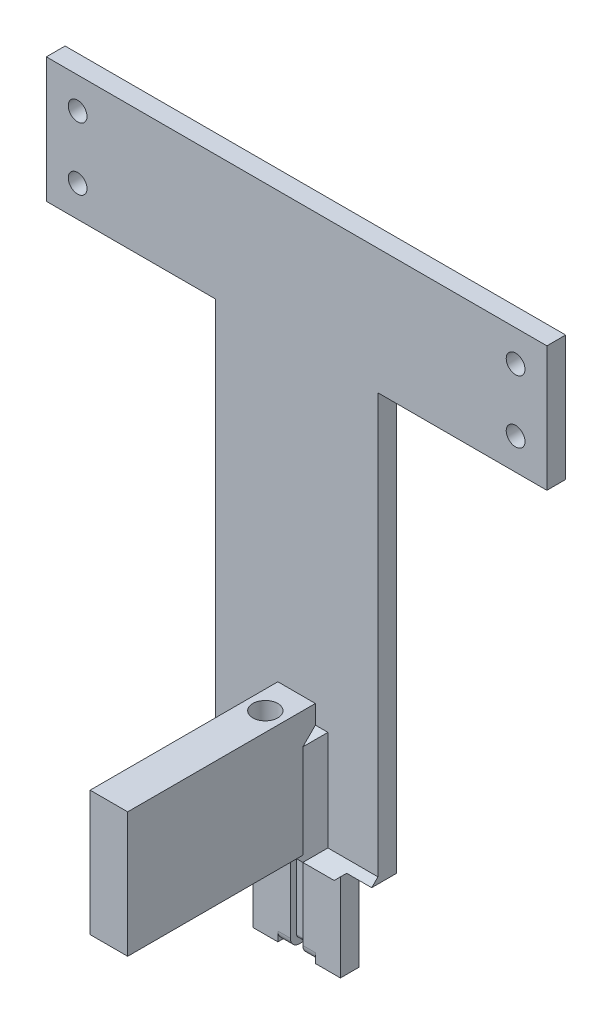
from build123d import *

# Parameters (mm, degrees)
SKETCH_1_W           = 80
SKETCH_1_H           = 20
EXTRUDE_1_DEPTH      = 3
SKETCH_2_W           = 6
SKETCH_2_H           = 20
EXTRUDE_2_DEPTH      = 95
SKETCH_3_W           = 6
SKETCH_3_H           = 15
EXTRUDE_3_DEPTH      = 80
CHAMFER_1_SIZE       = 10
CHAMFER_2_SIZE       = 10
FILLET_1_R           = 10
SKETCH_4_W           = 6
SKETCH_4_H           = 15
EXTRUDE_4_DEPTH      = 5
SKETCH_5_W           = 6
SKETCH_5_H           = 15
EXTRUDE_5_DEPTH      = 5
FILLET_2_R           = 2
CHAMFER_3_SIZE       = 3
SKETCH_6_R           = 1.5
CUT_EXTRUDE_1_DEPTH  = 30
SKETCH_7_W           = 26
SKETCH_7_H           = 3
EXTRUDE_6_DEPTH      = 68
CHAMFER_4_SIZE       = 10
SKETCH_8_W           = 6
SKETCH_8_H           = 13
EXTRUDE_7_DEPTH      = 100
CHAMFER_5_SIZE       = 5
CHAMFER_6_SIZE       = 2
SKETCH_9_W           = 99.532664039
SKETCH_9_H           = 104.077347625
CUT_EXTRUDE_3_DEPTH  = 30
SKETCH_14_W          = 15.593287018
SKETCH_14_H          = 53.78968733
CUT_EXTRUDE_5_DEPTH  = 57
SKETCH_15_W          = 6
SKETCH_15_H          = 25
EXTRUDE_8_DEPTH      = 5
SKETCH_16_W          = 6
SKETCH_16_H          = 25
EXTRUDE_9_DEPTH      = 5
CHAMFER_7_SIZE       = 5
SKETCH_17_W          = 6
SKETCH_17_H          = 23
CUT_EXTRUDE_6_DEPTH  = 100
SKETCH_20_W          = 26.699145715
SKETCH_20_H          = 4.006007242
CUT_EXTRUDE_7_DEPTH  = 133
SKETCH_21_W          = 6
SKETCH_21_H          = 15
EXTRUDE_11_DEPTH     = 30
SKETCH_22_R          = 2
CUT_EXTRUDE_8_DEPTH  = 27
EXTRUDE_12_DEPTH     = 3
SKETCH_26_W          = 4
SKETCH_26_H          = 3
EXTRUDE_14_DEPTH     = 16
SKETCH_27_W          = 4
SKETCH_27_H          = 13
EXTRUDE_21_DEPTH     = 6
SKETCH_28_R          = 1.5
CUT_EXTRUDE_9_DEPTH  = 22
CHAMFER_9_SIZE       = 2
CHAMFER_10_SIZE      = 2
CHAMFER_11_SIZE      = 1
SKETCH_29_W          = 6
SKETCH_29_H          = 28
EXTRUDE_22_DEPTH     = 20
SKETCH_30_W          = 6
SKETCH_30_H          = 20
EXTRUDE_23_DEPTH     = 2
CUT_EXTRUDE_START    = -20
SKETCH_31_R          = 2
CUT_EXTRUDE_10_DEPTH = 20
SKETCH_32_R          = 1.5
CUT_EXTRUDE_11_DEPTH = 10
SKETCH_33_W          = 6
SKETCH_33_H          = 30
CUT_EXTRUDE_12_DEPTH = 15
CUT_EXTRUDE_13_DEPTH = 6
EXTRUDE_24_DEPTH     = 2
EXTRUDE_25_REACH     = 136.146
SKETCH_37_W          = 2
SKETCH_37_H          = 3
EXTRUDE_26_DEPTH     = 2
EXTRUDE_27_DEPTH     = 2
EXTRUDE_28_REACH     = 136.146
CHAMFER_12_SIZE      = 1


# Some blends are built 0.0001 mm under size
with BuildPart() as part:
    # 草图1 → 凸台-拉伸1 (new body)
    with BuildSketch(Plane.XY):
        with Locations((-40, 10)):
            Rectangle(SKETCH_1_W, SKETCH_1_H)
    extrude(amount=EXTRUDE_1_DEPTH)

    # 草图2 → 凸台-拉伸2 (add)
    with BuildSketch(Plane.XY.offset(3)):
        with Locations((-40, 10)):
            Rectangle(SKETCH_2_W, SKETCH_2_H)
    extrude(amount=EXTRUDE_2_DEPTH)

    # 草图3 → 凸台-拉伸3 (add)
    with BuildSketch(Plane.XZ):
        with Locations((-40, 90.5)):
            Rectangle(SKETCH_3_W, SKETCH_3_H)
    extrude(amount=EXTRUDE_3_DEPTH)

    # 倒角1
    chamfer_1_edges = [part.edges().sort_by_distance(p)[0] for p in [
        (-43, 10, 3),
        (-37, 10, 3),
    ]]
    chamfer(chamfer_1_edges, length=CHAMFER_1_SIZE)

    # 倒角2
    chamfer_2_edges = [part.edges().sort_by_distance(p)[0] for p in [
        (-40, 0, 83),
    ]]
    chamfer(chamfer_2_edges, length=CHAMFER_2_SIZE)

    # 圆角1
    fillet_1_edges = [part.edges().sort_by_distance(p)[0] for p in [
        (-40, 20, 98),
    ]]
    fillet(fillet_1_edges, radius=FILLET_1_R)

    # 草图4 → 凸台-拉伸4 (add)
    with BuildSketch(Plane(origin=(0, 0, 83), x_dir=(-1, 0, 0), z_dir=(0, 0, -1))):
        with Locations((40, -72.5)):
            Rectangle(SKETCH_4_W, SKETCH_4_H)
    extrude(amount=EXTRUDE_4_DEPTH)

    # 草图5 → 凸台-拉伸5 (add)
    with BuildSketch(Plane.XY.offset(98)):
        with Locations((-40, -72.5)):
            Rectangle(SKETCH_5_W, SKETCH_5_H)
    extrude(amount=EXTRUDE_5_DEPTH)

    # 圆角2
    fillet_2_edges = [part.edges().sort_by_distance(p)[0] for p in [
        (-40, -65, 78),
        (-40, -65, 103),
    ]]
    fillet(fillet_2_edges, radius=FILLET_2_R)

    # 倒角3
    chamfer_3_edges = [part.edges().sort_by_distance(p)[0] for p in [
        (-40, -65, 83),
        (-40, -65, 98),
    ]]
    chamfer(chamfer_3_edges, length=CHAMFER_3_SIZE - 0.0001)  # a hair under: the kernel refuses the full size

    # 草图6 → 切除-拉伸1 (cut)
    with BuildSketch(Plane.XZ):
        with Locations(Location((-40, 8, 0), (0, 0, 270))):
            Circle(SKETCH_6_R)
        with Locations(Location((-40, 23, 0), (0, 0, 270))):
            Circle(SKETCH_6_R)
    extrude(amount=-CUT_EXTRUDE_1_DEPTH, mode=Mode.SUBTRACT)

    # 草图7 → 凸台-拉伸6 (add)
    with BuildSketch(Plane.XZ):
        with Locations((-40, 1.5)):
            Rectangle(SKETCH_7_W, SKETCH_7_H)
    extrude(amount=EXTRUDE_6_DEPTH)

    # 倒角4
    chamfer_4_edges = [part.edges().sort_by_distance(p)[0] for p in [
        (-53, -68, 1.5),
        (-27, -68, 1.5),
    ]]
    chamfer(chamfer_4_edges, length=CHAMFER_4_SIZE)

    # 草图8 → 凸台-拉伸7 (add)
    with BuildSketch(Plane.XY.offset(3)):
        with Locations((-40, -73.5)):
            Rectangle(SKETCH_8_W, SKETCH_8_H)
    extrude(amount=EXTRUDE_7_DEPTH)

    # 倒角5
    chamfer_5_edges = [part.edges().sort_by_distance(p)[0] for p in [
        (-40, -67, 3),
    ]]
    chamfer(chamfer_5_edges, length=CHAMFER_5_SIZE)

    # 倒角6
    # the kernel refuses this chamfer: 2 mm, written as the material it adds along each edge
    with BuildSketch(Plane(origin=(-37, -56.856634024, 3), x_dir=(1, 0, 0), z_dir=(0, -1, 0))) as chamfer_6_piece_1_section:
        Polygon((CHAMFER_6_SIZE, 0), (0, CHAMFER_6_SIZE), (0, 0), align=None)
    chamfer_6_piece_1 = extrude(amount=16.286731952, mode=Mode.PRIVATE)
    chamfer_6_piece_1 = split(chamfer_6_piece_1, bisect_by=Plane(origin=(-37, -59.428317012, 0.428317012), z_dir=(0, -0.7071067811865476, -0.7071067811865476)), keep=Keep.TOP, mode=Mode.PRIVATE)
    chamfer_6_piece_1 = split(chamfer_6_piece_1, bisect_by=Plane(origin=(-31.428317012, -62.428317012, 3), z_dir=(-0.7071067811865475, 0.7071067811865477, -1.922962686383564e-15)), keep=Keep.TOP, mode=Mode.PRIVATE)
    add(chamfer_6_piece_1)
    with BuildSketch(Plane(origin=(-43, -73.143365976, 3), x_dir=(-1, 0, 0), z_dir=(0, 1, 0))) as chamfer_6_piece_2_section:
        Polygon((CHAMFER_6_SIZE, 0), (0, CHAMFER_6_SIZE), (0, 0), align=None)
    chamfer_6_piece_2 = extrude(amount=16.286731952, mode=Mode.PRIVATE)
    chamfer_6_piece_2 = split(chamfer_6_piece_2, bisect_by=Plane(origin=(-43, -67.571682988, 8.571682988), z_dir=(0, -0.7071067811865476, -0.7071067811865476)), keep=Keep.TOP, mode=Mode.PRIVATE)
    chamfer_6_piece_2 = split(chamfer_6_piece_2, bisect_by=Plane(origin=(-40.428317012, -70.571682988, 3), z_dir=(0.7071067811865476, 0.7071067811865476, 3.5574809698095944e-15)), keep=Keep.TOP, mode=Mode.PRIVATE)
    add(chamfer_6_piece_2)

    # 草图9 → 切除-拉伸3 (cut)
    with BuildSketch(Plane(origin=(0, 20, 0), x_dir=(1, 0, 0), z_dir=(0, 1, 0))):
        with Locations((-30.233667981, -55.038673813)):
            Rectangle(SKETCH_9_W, SKETCH_9_H)
    extrude(amount=-CUT_EXTRUDE_3_DEPTH, mode=Mode.SUBTRACT)

    # 草图14 → 切除-拉伸5 (cut)
    with BuildSketch(Plane(origin=(0, -10, 0), x_dir=(1, 0, 0), z_dir=(0, 1, 0))):
        with Locations((-38.927067407, -81.040006974)):
            Rectangle(SKETCH_14_W, SKETCH_14_H)
    extrude(amount=-CUT_EXTRUDE_5_DEPTH, mode=Mode.SUBTRACT)

    # 草图15 → 凸台-拉伸8 (add)
    with BuildSketch(Plane(origin=(0, -67, 0), x_dir=(1, 0, 0), z_dir=(0, 1, 0))):
        with Locations((-40, -90.5)):
            Rectangle(SKETCH_15_W, SKETCH_15_H)
    extrude(amount=EXTRUDE_8_DEPTH)

    # 草图16 → 凸台-拉伸9 (add)
    with BuildSketch(Plane.XZ.offset(80)):
        with Locations((-40, 90.5)):
            Rectangle(SKETCH_16_W, SKETCH_16_H)
    extrude(amount=EXTRUDE_9_DEPTH)

    # 倒角7
    chamfer_7_edges = [part.edges().sort_by_distance(p)[0] for p in [
        (-40, -80, 78),
        (-40, -67, 78),
    ]]
    chamfer(chamfer_7_edges, length=CHAMFER_7_SIZE - 0.0001)  # a hair under: the kernel refuses the full size

    # 草图17 → 切除-拉伸6 (cut)
    with BuildSketch(Plane.XY.offset(103)):
        with Locations((-40, -73.5)):
            Rectangle(SKETCH_17_W, SKETCH_17_H)
    extrude(amount=-CUT_EXTRUDE_6_DEPTH, mode=Mode.SUBTRACT)

    # 草图20 → 切除-拉伸7 (cut)
    with BuildSketch(Plane(origin=(0, 20, 0), x_dir=(1, 0, 0), z_dir=(0, 1, 0))):
        with Locations((-37.936501357, -5.003003621)):
            Rectangle(SKETCH_20_W, SKETCH_20_H)
    extrude(amount=-CUT_EXTRUDE_7_DEPTH, mode=Mode.SUBTRACT)

    # 草图21 → 凸台-拉伸11 (add)
    with BuildSketch(Plane.XY.offset(3)):
        with Locations((-40, -60.5)):
            Rectangle(SKETCH_21_W, SKETCH_21_H)
    extrude(amount=EXTRUDE_11_DEPTH)

    # 草图22 → 切除-拉伸8 (cut)
    with BuildSketch(Plane(origin=(0, -53, 0), x_dir=(1, 0, 0), z_dir=(0, 1, 0))):
        with Locations(Location((-40, -8, 0), (0, 0, 270))):
            Circle(SKETCH_22_R)
    extrude(amount=-CUT_EXTRUDE_8_DEPTH, mode=Mode.SUBTRACT)

    # 草图24 → 凸台-拉伸12 (add)
    with BuildSketch(Plane(origin=(0, 0, 0), x_dir=(-1, 0, 0), z_dir=(0, 0, -1))):
        Polygon((27, -58), (27, -68), (37, -68), align=None)
        Polygon((53, -58), (53, -68), (43, -68), align=None)
    extrude(amount=-EXTRUDE_12_DEPTH)

    # 草图26 → 凸台-拉伸14 (add)
    with BuildSketch(Plane.XZ.offset(68)):
        with Locations((-45, 1.5)):
            Rectangle(SKETCH_26_W, SKETCH_26_H)
        with Locations((-35, 1.5)):
            Rectangle(SKETCH_26_W, SKETCH_26_H)
    extrude(amount=EXTRUDE_14_DEPTH)

    # 草图27 → 凸台-拉伸21 (add)
    with BuildSketch(Plane.XY.offset(3)):
        with Locations((-45, -75.5)):
            Rectangle(SKETCH_27_W, SKETCH_27_H)
        with Locations((-35, -75.5)):
            Rectangle(SKETCH_27_W, SKETCH_27_H)
    extrude(amount=EXTRUDE_21_DEPTH)

    # 草图28 → 切除-拉伸9 (cut)
    with BuildSketch(Plane(origin=(-33, 0, 0), x_dir=(0, 0, -1), z_dir=(1, 0, 0))):
        with Locations((-6, -75.5)):
            Circle(SKETCH_28_R)
    extrude(amount=-CUT_EXTRUDE_9_DEPTH, mode=Mode.SUBTRACT)

    # 倒角8
    # the kernel refuses this chamfer: 2 mm, written as the material it adds along each edge
    with BuildSketch(Plane(origin=(-53.152771873, -69, 3), x_dir=(0, 1, 0), z_dir=(1, 0, 0))) as chamfer_8_piece_1_section:
        with BuildLine():
            Line((2.424264069, -0.424264069), (-0.424264069, 2.424264069))
            Line((-0.424264069, 2.424264069), (-0.724264069, 2.424264069))
            ThreePointArc((-0.724264069, 2.424264069), (-0.3, 1.212132034), (-0.3, 0))
            Line((-0.3, 0), (0, -0.3))
            ThreePointArc((0, -0.3), (1.212132034, -0.3), (2.424264069, -0.724264069))
            Line((2.424264069, -0.724264069), (2.424264069, -0.424264069))
        make_face()
    chamfer_8_piece_1 = extrude(amount=10.152771873, mode=Mode.PRIVATE)
    chamfer_8_piece_1 = split(chamfer_8_piece_1, bisect_by=Plane(origin=(-47, -69, 3), z_dir=(-1, 0, 0)), keep=Keep.TOP, mode=Mode.PRIVATE)
    chamfer_8_piece_1 = split(chamfer_8_piece_1, bisect_by=Plane(origin=(-53.152771873, -68, 3), z_dir=(0, 1, 0)), keep=Keep.TOP, mode=Mode.PRIVATE)
    chamfer_8_piece_1 = split(chamfer_8_piece_1, bisect_by=Plane(origin=(-53, -69, 3), z_dir=(1, 0, 0)), keep=Keep.TOP, mode=Mode.PRIVATE)
    add(chamfer_8_piece_1)
    with BuildSketch(Plane(origin=(-47, -69, 3), x_dir=(0, 1, 0), z_dir=(1, 0, 0))) as chamfer_8_piece_2_section:
        with BuildLine():
            Line((2.424264069, -0.424264069), (-0.424264069, 2.424264069))
            Line((-0.424264069, 2.424264069), (-0.724264069, 2.424264069))
            ThreePointArc((-0.724264069, 2.424264069), (-0.3, 1.212132034), (-0.3, 0))
            Line((-0.3, 0), (0, -0.3))
            ThreePointArc((0, -0.3), (1.212132034, -0.3), (2.424264069, -0.724264069))
            Line((2.424264069, -0.724264069), (2.424264069, -0.424264069))
        make_face()
    chamfer_8_piece_2 = extrude(amount=4, mode=Mode.PRIVATE)
    chamfer_8_piece_2 = split(chamfer_8_piece_2, bisect_by=Plane(origin=(-47, -68, 3), z_dir=(0, 1, 0)), keep=Keep.TOP, mode=Mode.PRIVATE)
    add(chamfer_8_piece_2)
    with BuildSketch(Plane(origin=(-47, -69, 3), x_dir=(0, 1, 0), z_dir=(1, 0, 0))) as chamfer_8_piece_3_section:
        with BuildLine():
            Line((2.424264069, -0.424264069), (-0.424264069, 2.424264069))
            Line((-0.424264069, 2.424264069), (-0.724264069, 2.424264069))
            ThreePointArc((-0.724264069, 2.424264069), (-0.3, 1.212132034), (-0.3, 0))
            Line((-0.3, 0), (0, -0.3))
            ThreePointArc((0, -0.3), (1.212132034, -0.3), (2.424264069, -0.724264069))
            Line((2.424264069, -0.724264069), (2.424264069, -0.424264069))
        make_face()
    chamfer_8_piece_3 = extrude(amount=4, mode=Mode.PRIVATE)
    chamfer_8_piece_3 = split(chamfer_8_piece_3, bisect_by=Plane(origin=(-47, -68, 3), z_dir=(0, -1, 0)), keep=Keep.TOP, mode=Mode.PRIVATE)
    add(chamfer_8_piece_3)
    with BuildSketch(Plane(origin=(-47, -69, 3), x_dir=(0, 1, 0), z_dir=(1, 0, 0))) as chamfer_8_piece_4_section:
        with BuildLine():
            Line((2.424264069, -0.424264069), (-0.424264069, 2.424264069))
            Line((-0.424264069, 2.424264069), (-0.724264069, 2.424264069))
            ThreePointArc((-0.724264069, 2.424264069), (-0.3, 1.212132034), (-0.3, 0))
            Line((-0.3, 0), (0, -0.3))
            ThreePointArc((0, -0.3), (1.212132034, -0.3), (2.424264069, -0.724264069))
            Line((2.424264069, -0.724264069), (2.424264069, -0.424264069))
        make_face()
    chamfer_8_piece_4 = extrude(amount=10.152771873, mode=Mode.PRIVATE)
    chamfer_8_piece_4 = split(chamfer_8_piece_4, bisect_by=Plane(origin=(-37, -69, 3), z_dir=(-1, 0, 0)), keep=Keep.TOP, mode=Mode.PRIVATE)
    chamfer_8_piece_4 = split(chamfer_8_piece_4, bisect_by=Plane(origin=(-43, -69, 3), z_dir=(1, 0, 0)), keep=Keep.TOP, mode=Mode.PRIVATE)
    chamfer_8_piece_4 = split(chamfer_8_piece_4, bisect_by=Plane(origin=(-47, -68, 3), z_dir=(0, 1, 0)), keep=Keep.TOP, mode=Mode.PRIVATE)
    add(chamfer_8_piece_4)
    with BuildSketch(Plane(origin=(-47, -69, 3), x_dir=(0, 1, 0), z_dir=(1, 0, 0))) as chamfer_8_piece_5_section:
        with BuildLine():
            Line((2.424264069, -0.424264069), (-0.424264069, 2.424264069))
            Line((-0.424264069, 2.424264069), (-0.724264069, 2.424264069))
            ThreePointArc((-0.724264069, 2.424264069), (-0.3, 1.212132034), (-0.3, 0))
            Line((-0.3, 0), (0, -0.3))
            ThreePointArc((0, -0.3), (1.212132034, -0.3), (2.424264069, -0.724264069))
            Line((2.424264069, -0.724264069), (2.424264069, -0.424264069))
        make_face()
    chamfer_8_piece_5 = extrude(amount=10.152771873, mode=Mode.PRIVATE)
    chamfer_8_piece_5 = split(chamfer_8_piece_5, bisect_by=Plane(origin=(-37, -69, 3), z_dir=(1, 0, 0)), keep=Keep.TOP, mode=Mode.PRIVATE)
    chamfer_8_piece_5 = split(chamfer_8_piece_5, bisect_by=Plane(origin=(-47, -68, 3), z_dir=(0, 1, 0)), keep=Keep.TOP, mode=Mode.PRIVATE)
    add(chamfer_8_piece_5)
    with BuildSketch(Plane(origin=(-47, -69, 3), x_dir=(0, 1, 0), z_dir=(1, 0, 0))) as chamfer_8_piece_6_section:
        with BuildLine():
            Line((2.424264069, -0.424264069), (-0.424264069, 2.424264069))
            Line((-0.424264069, 2.424264069), (-0.724264069, 2.424264069))
            ThreePointArc((-0.724264069, 2.424264069), (-0.3, 1.212132034), (-0.3, 0))
            Line((-0.3, 0), (0, -0.3))
            ThreePointArc((0, -0.3), (1.212132034, -0.3), (2.424264069, -0.724264069))
            Line((2.424264069, -0.724264069), (2.424264069, -0.424264069))
        make_face()
    chamfer_8_piece_6 = extrude(amount=10.152771873, mode=Mode.PRIVATE)
    chamfer_8_piece_6 = split(chamfer_8_piece_6, bisect_by=Plane(origin=(-37, -69, 3), z_dir=(1, 0, 0)), keep=Keep.TOP, mode=Mode.PRIVATE)
    chamfer_8_piece_6 = split(chamfer_8_piece_6, bisect_by=Plane(origin=(-47, -68, 3), z_dir=(0, -1, 0)), keep=Keep.TOP, mode=Mode.PRIVATE)
    add(chamfer_8_piece_6)
    with BuildSketch(Plane(origin=(-43.152771873, -69, 3), x_dir=(0, 1, 0), z_dir=(1, 0, 0))) as chamfer_8_piece_7_section:
        with BuildLine():
            Line((2.424264069, -0.424264069), (-0.424264069, 2.424264069))
            Line((-0.424264069, 2.424264069), (-0.724264069, 2.424264069))
            ThreePointArc((-0.724264069, 2.424264069), (-0.3, 1.212132034), (-0.3, 0))
            Line((-0.3, 0), (0, -0.3))
            ThreePointArc((0, -0.3), (1.212132034, -0.3), (2.424264069, -0.724264069))
            Line((2.424264069, -0.724264069), (2.424264069, -0.424264069))
        make_face()
    chamfer_8_piece_7 = extrude(amount=10.152771873, mode=Mode.PRIVATE)
    chamfer_8_piece_7 = split(chamfer_8_piece_7, bisect_by=Plane(origin=(-43.152771873, -68, 3), z_dir=(0, 1, 0)), keep=Keep.TOP, mode=Mode.PRIVATE)
    chamfer_8_piece_7 = split(chamfer_8_piece_7, bisect_by=Plane(origin=(-43, -69, 3), z_dir=(-1, 0, 0)), keep=Keep.TOP, mode=Mode.PRIVATE)
    add(chamfer_8_piece_7)
    with BuildSketch(Plane(origin=(-43.152771873, -69, 3), x_dir=(0, 1, 0), z_dir=(1, 0, 0))) as chamfer_8_piece_8_section:
        with BuildLine():
            Line((2.424264069, -0.424264069), (-0.424264069, 2.424264069))
            Line((-0.424264069, 2.424264069), (-0.724264069, 2.424264069))
            ThreePointArc((-0.724264069, 2.424264069), (-0.3, 1.212132034), (-0.3, 0))
            Line((-0.3, 0), (0, -0.3))
            ThreePointArc((0, -0.3), (1.212132034, -0.3), (2.424264069, -0.724264069))
            Line((2.424264069, -0.724264069), (2.424264069, -0.424264069))
        make_face()
    chamfer_8_piece_8 = extrude(amount=10.152771873, mode=Mode.PRIVATE)
    chamfer_8_piece_8 = split(chamfer_8_piece_8, bisect_by=Plane(origin=(-43.152771873, -68, 3), z_dir=(0, -1, 0)), keep=Keep.TOP, mode=Mode.PRIVATE)
    chamfer_8_piece_8 = split(chamfer_8_piece_8, bisect_by=Plane(origin=(-43, -69, 3), z_dir=(-1, 0, 0)), keep=Keep.TOP, mode=Mode.PRIVATE)
    add(chamfer_8_piece_8)
    with BuildSketch(Plane(origin=(-43.152771873, -69, 3), x_dir=(0, 1, 0), z_dir=(1, 0, 0))) as chamfer_8_piece_9_section:
        with BuildLine():
            Line((2.424264069, -0.424264069), (-0.424264069, 2.424264069))
            Line((-0.424264069, 2.424264069), (-0.724264069, 2.424264069))
            ThreePointArc((-0.724264069, 2.424264069), (-0.3, 1.212132034), (-0.3, 0))
            Line((-0.3, 0), (0, -0.3))
            ThreePointArc((0, -0.3), (1.212132034, -0.3), (2.424264069, -0.724264069))
            Line((2.424264069, -0.724264069), (2.424264069, -0.424264069))
        make_face()
    chamfer_8_piece_9 = extrude(amount=10.152771873, mode=Mode.PRIVATE)
    chamfer_8_piece_9 = split(chamfer_8_piece_9, bisect_by=Plane(origin=(-43.152771873, -68, 3), z_dir=(0, 1, 0)), keep=Keep.TOP, mode=Mode.PRIVATE)
    chamfer_8_piece_9 = split(chamfer_8_piece_9, bisect_by=Plane(origin=(-37, -69, 3), z_dir=(-1, 0, 0)), keep=Keep.TOP, mode=Mode.PRIVATE)
    chamfer_8_piece_9 = split(chamfer_8_piece_9, bisect_by=Plane(origin=(-43, -69, 3), z_dir=(1, 0, 0)), keep=Keep.TOP, mode=Mode.PRIVATE)
    add(chamfer_8_piece_9)
    with BuildSketch(Plane(origin=(-37, -69, 3), x_dir=(0, 1, 0), z_dir=(1, 0, 0))) as chamfer_8_piece_10_section:
        with BuildLine():
            Line((2.424264069, -0.424264069), (-0.424264069, 2.424264069))
            Line((-0.424264069, 2.424264069), (-0.724264069, 2.424264069))
            ThreePointArc((-0.724264069, 2.424264069), (-0.3, 1.212132034), (-0.3, 0))
            Line((-0.3, 0), (0, -0.3))
            ThreePointArc((0, -0.3), (1.212132034, -0.3), (2.424264069, -0.724264069))
            Line((2.424264069, -0.724264069), (2.424264069, -0.424264069))
        make_face()
    chamfer_8_piece_10 = extrude(amount=4, mode=Mode.PRIVATE)
    chamfer_8_piece_10 = split(chamfer_8_piece_10, bisect_by=Plane(origin=(-37, -68, 3), z_dir=(0, 1, 0)), keep=Keep.TOP, mode=Mode.PRIVATE)
    add(chamfer_8_piece_10)
    with BuildSketch(Plane(origin=(-37, -69, 3), x_dir=(0, 1, 0), z_dir=(1, 0, 0))) as chamfer_8_piece_11_section:
        with BuildLine():
            Line((2.424264069, -0.424264069), (-0.424264069, 2.424264069))
            Line((-0.424264069, 2.424264069), (-0.724264069, 2.424264069))
            ThreePointArc((-0.724264069, 2.424264069), (-0.3, 1.212132034), (-0.3, 0))
            Line((-0.3, 0), (0, -0.3))
            ThreePointArc((0, -0.3), (1.212132034, -0.3), (2.424264069, -0.724264069))
            Line((2.424264069, -0.724264069), (2.424264069, -0.424264069))
        make_face()
    chamfer_8_piece_11 = extrude(amount=4, mode=Mode.PRIVATE)
    chamfer_8_piece_11 = split(chamfer_8_piece_11, bisect_by=Plane(origin=(-37, -68, 3), z_dir=(0, -1, 0)), keep=Keep.TOP, mode=Mode.PRIVATE)
    add(chamfer_8_piece_11)
    with BuildSketch(Plane(origin=(-37, -69, 3), x_dir=(0, 1, 0), z_dir=(1, 0, 0))) as chamfer_8_piece_12_section:
        with BuildLine():
            Line((2.424264069, -0.424264069), (-0.424264069, 2.424264069))
            Line((-0.424264069, 2.424264069), (-0.724264069, 2.424264069))
            ThreePointArc((-0.724264069, 2.424264069), (-0.3, 1.212132034), (-0.3, 0))
            Line((-0.3, 0), (0, -0.3))
            ThreePointArc((0, -0.3), (1.212132034, -0.3), (2.424264069, -0.724264069))
            Line((2.424264069, -0.724264069), (2.424264069, -0.424264069))
        make_face()
    chamfer_8_piece_12 = extrude(amount=10.152771873, mode=Mode.PRIVATE)
    chamfer_8_piece_12 = split(chamfer_8_piece_12, bisect_by=Plane(origin=(-27, -69, 3), z_dir=(-1, 0, 0)), keep=Keep.TOP, mode=Mode.PRIVATE)
    chamfer_8_piece_12 = split(chamfer_8_piece_12, bisect_by=Plane(origin=(-37, -68, 3), z_dir=(0, 1, 0)), keep=Keep.TOP, mode=Mode.PRIVATE)
    chamfer_8_piece_12 = split(chamfer_8_piece_12, bisect_by=Plane(origin=(-33, -69, 3), z_dir=(1, 0, 0)), keep=Keep.TOP, mode=Mode.PRIVATE)
    add(chamfer_8_piece_12)

    # 倒角9
    # the kernel refuses this chamfer: 2 mm, written as the material it adds along each edge
    with BuildSketch(Plane(origin=(-43, -53, 3), x_dir=(0, 0, 1), z_dir=(0, -1, 0)), Plane(origin=(-37, -72.143365976, 3), x_dir=(0, 0, 1), z_dir=(0, 1, 0))) as chamfer_9_piece_1:
        Polygon((CHAMFER_9_SIZE, 0), (0, CHAMFER_9_SIZE), (0, 0), align=None)
    extrude(amount=19.143365976)
    with BuildSketch(Plane(origin=(-37, -53, 3), x_dir=(0, 0, 1), z_dir=(-1, 0, 0))) as chamfer_9_piece_2:
        Polygon((CHAMFER_9_SIZE, 0), (0, CHAMFER_9_SIZE), (0, 0), align=None)
    extrude(amount=6)
    with BuildSketch(Plane(origin=(-37, -53, 3), x_dir=(0, 0, 1), z_dir=(-1, 0, 0))) as chamfer_9_piece_3a_section:
        Polygon((CHAMFER_9_SIZE, 0), (0, CHAMFER_9_SIZE), (0, 0), align=None)
    chamfer_9_piece_3a = extrude(amount=11.143365976, mode=Mode.PRIVATE)
    chamfer_9_piece_3a = split(chamfer_9_piece_3a, bisect_by=Plane(origin=(-43, -53, 3), z_dir=(-1, 0, 0)), keep=Keep.TOP, mode=Mode.PRIVATE)
    with BuildSketch(Plane(origin=(-43, -47.856634024, 3), x_dir=(0, 0, 1), z_dir=(0, -1, 0))) as chamfer_9_piece_3b_section:
        Polygon((CHAMFER_9_SIZE, 0), (0, CHAMFER_9_SIZE), (0, 0), align=None)
    chamfer_9_piece_3b = extrude(amount=24.286731952, mode=Mode.PRIVATE)
    chamfer_9_piece_3b = split(chamfer_9_piece_3b, bisect_by=Plane(origin=(-43, -53, 3), z_dir=(0, 1, 0)), keep=Keep.TOP, mode=Mode.PRIVATE)
    chamfer_9_piece_3 = chamfer_9_piece_3a & chamfer_9_piece_3b
    add(chamfer_9_piece_3)
    with BuildSketch(Plane(origin=(-31.856634024, -53, 3), x_dir=(0, 0, 1), z_dir=(-1, 0, 0))) as chamfer_9_piece_4a_section:
        Polygon((CHAMFER_9_SIZE, 0), (0, CHAMFER_9_SIZE), (0, 0), align=None)
    chamfer_9_piece_4a = extrude(amount=11.143365976, mode=Mode.PRIVATE)
    chamfer_9_piece_4a = split(chamfer_9_piece_4a, bisect_by=Plane(origin=(-37, -53, 3), z_dir=(1, 0, 0)), keep=Keep.TOP, mode=Mode.PRIVATE)
    with BuildSketch(Plane(origin=(-37, -72.143365976, 3), x_dir=(0, 0, 1), z_dir=(0, 1, 0))) as chamfer_9_piece_4b_section:
        Polygon((CHAMFER_9_SIZE, 0), (0, CHAMFER_9_SIZE), (0, 0), align=None)
    chamfer_9_piece_4b = extrude(amount=24.286731952, mode=Mode.PRIVATE)
    chamfer_9_piece_4b = split(chamfer_9_piece_4b, bisect_by=Plane(origin=(-37, -53, 3), z_dir=(0, 1, 0)), keep=Keep.TOP, mode=Mode.PRIVATE)
    chamfer_9_piece_4 = chamfer_9_piece_4a & chamfer_9_piece_4b
    add(chamfer_9_piece_4)

    # 倒角10
    chamfer_10_edges = [part.edges().sort_by_distance(p)[0] for p in [
        (-47, -68, 2),
        (-33, -68, 2),
    ]]
    chamfer(chamfer_10_edges, length=CHAMFER_10_SIZE)

    # 倒角11
    chamfer_11_edges = [part.edges().sort_by_distance(p)[0] for p in [
        (-43, -68, 2.5),
        (-37, -68, 2.5),
    ]]
    chamfer(chamfer_11_edges, length=CHAMFER_11_SIZE)

    # 草图29 → 凸台-拉伸22 (add)
    with BuildSketch(Plane(origin=(0, -53, 0), x_dir=(1, 0, 0), z_dir=(0, 1, 0))):
        with Locations((-40, -19)):
            Rectangle(SKETCH_29_W, SKETCH_29_H)
    extrude(amount=EXTRUDE_22_DEPTH)

    # 草图30 → 凸台-拉伸23 (add)
    with BuildSketch(Plane(origin=(0, 0, 5), x_dir=(-1, 0, 0), z_dir=(0, 0, -1))):
        with Locations((40, -43)):
            Rectangle(SKETCH_30_W, SKETCH_30_H)
    extrude(amount=EXTRUDE_23_DEPTH)

    # 草图31 → 切除-拉伸10 (cut)
    with BuildSketch(Plane.XZ.offset(53).offset(CUT_EXTRUDE_START)):
        with Locations(Location((-40, 8, 0), (0, 0, 90))):
            Circle(SKETCH_31_R)
    extrude(amount=CUT_EXTRUDE_10_DEPTH, mode=Mode.SUBTRACT)

    # 草图32 → 切除-拉伸11 (cut)
    with BuildSketch(Plane.XY.offset(3)):
        with Locations((-75, 15)):
            Circle(SKETCH_32_R)
        with Locations((-75, 5)):
            Circle(SKETCH_32_R)
        with Locations((-5, 5)):
            Circle(SKETCH_32_R)
        with Locations((-5, 15)):
            Circle(SKETCH_32_R)
    extrude(amount=-CUT_EXTRUDE_11_DEPTH, mode=Mode.SUBTRACT)

    # 草图33 → 切除-拉伸12 (cut)
    with BuildSketch(Plane(origin=(0, -33, 0), x_dir=(1, 0, 0), z_dir=(0, 1, 0))):
        with Locations((-40, -18)):
            Rectangle(SKETCH_33_W, SKETCH_33_H)
    extrude(amount=-CUT_EXTRUDE_12_DEPTH, mode=Mode.SUBTRACT)

    # 草图34 → 切除-拉伸13 (cut)
    with BuildSketch(Plane.XY.offset(9)):
        Polygon((-37, -82), (-33, -82), (-33, -70), (-32, -69), (-37, -69), (-43, -69), (-48, -69), (-47, -70), (-47, -82), (-43, -82), align=None)
    extrude(amount=-CUT_EXTRUDE_13_DEPTH, mode=Mode.SUBTRACT)

    # 草图36 → 凸台-拉伸24 (add)
    with BuildSketch(Plane(origin=(-43, 0, 0), x_dir=(0, 0, -1), z_dir=(1, 0, 0))):
        with BuildLine():
            Line((-3, -82.5), (0, -82.5))
            ThreePointArc((0, -82.5), (-1.5, -84), (-3, -82.5))
        make_face()
    extrude(amount=EXTRUDE_24_DEPTH)

    # 草图37 → 凸台-拉伸25 (add, up to next)
    with BuildSketch(Plane(origin=(0, -82.5, 0), x_dir=(1, 0, 0), z_dir=(0, 1, 0)), mode=Mode.PRIVATE) as extrude_25_sk1:
        with Locations((-42, -1.5)):
            Rectangle(SKETCH_37_W, SKETCH_37_H)
    extrude_25_tool1 = extrude(extrude_25_sk1.sketch, amount=EXTRUDE_25_REACH, mode=Mode.PRIVATE) - part.part
    add(extrude_25_tool1.solids().sort_by_distance((-42, -82.5, 1.5))[0])

    # 草图38 → 凸台-拉伸26 (add)
    with BuildSketch(Plane(origin=(-41, 0, 0), x_dir=(0, 0, -1), z_dir=(1, 0, 0))):
        with BuildLine():
            Line((-2, -82.5), (-1, -82.5))
            ThreePointArc((-1, -82.5), (-1.5, -83), (-2, -82.5))
        make_face()
    extrude(amount=EXTRUDE_26_DEPTH)

    # 草图39 → 凸台-拉伸27 (add)
    with BuildSketch(Plane(origin=(-39, 0, 0), x_dir=(0, 0, -1), z_dir=(1, 0, 0))):
        with BuildLine():
            Line((-3, -82.5), (0, -82.5))
            ThreePointArc((0, -82.5), (-1.5, -84), (-3, -82.5))
        make_face()
    extrude(amount=EXTRUDE_27_DEPTH)

    # 草图40 → 凸台-拉伸28 (add, up to next)
    with BuildSketch(Plane(origin=(0, -82.5, 0), x_dir=(1, 0, 0), z_dir=(0, 1, 0)), mode=Mode.PRIVATE) as extrude_28_sk1:
        Polygon((-41, -1), (-41, -2), (-39, -2), (-39, -3), (-37, -3), (-37, 0), (-39, 0), (-39, -1), align=None)
    extrude_28_tool1 = extrude(extrude_28_sk1.sketch, amount=EXTRUDE_28_REACH, mode=Mode.PRIVATE) - part.part
    add(extrude_28_tool1.solids().sort_by_distance((-38.5, -82.5, 1.5))[0])

    # 倒角12
    chamfer_12_edges = [part.edges().sort_by_distance(p)[0] for p in [
        (-40, -68, 0),
    ]]
    chamfer(chamfer_12_edges, length=CHAMFER_12_SIZE - 0.0001)  # a hair under: the kernel refuses the full size


solid = part.part
